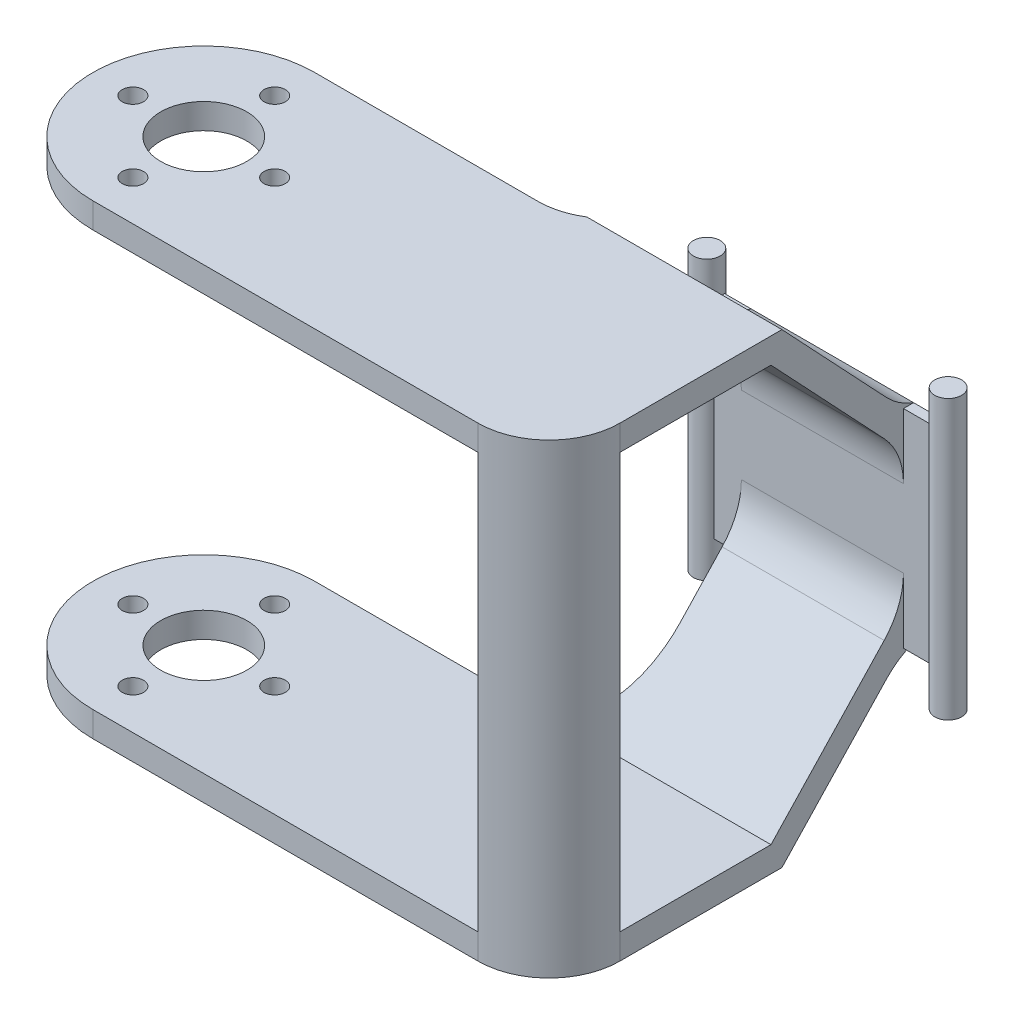
from build123d import *

# Parameters (mm, degrees)
SKETCH1_W           = 23.83
SKETCH1_H           = 1
BOSS_EXTRUDE1_DEPTH = 20.5
SKETCH2_R           = 1.325
BOSS_EXTRUDE2_DEPTH = 13.75
BOSS_EXTRUDE4_DEPTH = 8
SKETCH5_W           = 21.919818374
SKETCH5_H           = 2.5
BOSS_EXTRUDE5_DEPTH = 40
SKETCH6_R           = 4.25
SKETCH6_R_2         = 1.05
CUT_EXTRUDE1_DEPTH  = 76.367433285
FILLET1_R           = 7
FILLET2_R           = 7
FILLET3_R           = 7
BOSS_EXTRUDE6_START = 41
BOSS_EXTRUDE6_DEPTH = 41


with BuildPart() as part:
    # Sketch1 → Boss-Extrude1 (new body)
    with BuildSketch(Plane(origin=(0, 0, 0), x_dir=(1, 0, 0), z_dir=(0, 1, 0))):
        Rectangle(SKETCH1_W, SKETCH1_H)
    extrude(amount=BOSS_EXTRUDE1_DEPTH)

    # Sketch2 → Boss-Extrude2 (add, symmetric)
    with BuildSketch(Plane(origin=(0, 10.25, 0), x_dir=(1, 0, 0), z_dir=(0, 1, 0))):
        with Locations(Location((-11.915, 0, 0), (0, 0, 270))):
            Circle(SKETCH2_R)
        with Locations(Location((11.915, 0, 0), (0, 0, 270))):
            Circle(SKETCH2_R)
    extrude(amount=BOSS_EXTRUDE2_DEPTH, both=True)

    # Sketch4 → Boss-Extrude4 (add, symmetric)
    with BuildSketch(Plane(origin=(0, 0, 0), x_dir=(0, 0, -1), z_dir=(1, 0, 0))):
        Polygon((-0.5, 16.852307022), (-0.5, 20.5), (-12.5, 33.25), (-35.5, 33.25), (-35.5, 30.75), (-13.580181626, 30.75), align=None)
        Polygon((-0.5, 0), (-0.5, 3.647692978), (-13.580181626, -10.25), (-35.5, -10.25), (-35.5, -12.75), (-12.5, -12.75), align=None)
    extrude(amount=BOSS_EXTRUDE4_DEPTH, both=True)

    # Sketch5 → Boss-Extrude5 (add)
    with BuildSketch(Plane.ZY.offset(8)):
        with Locations((24.540090813, 32)):
            Rectangle(SKETCH5_W, SKETCH5_H)
        with Locations((24.540090813, -11.5)):
            Rectangle(SKETCH5_W, SKETCH5_H)
    extrude(amount=BOSS_EXTRUDE5_DEPTH)

    # Sketch6 → Cut-Extrude1 (cut, through all)
    with BuildSketch(Plane(origin=(0, 33.25, 0), x_dir=(1, 0, 0), z_dir=(0, 1, 0))):
        with Locations(Location((-37.040090813, -24.540090813, 0), (0, 0, 270))):
            Circle(SKETCH6_R)
        with Locations(Location((-44.040090813, -24.540090813, 0), (0, 0, 270))):
            Circle(SKETCH6_R_2)
        with Locations(Location((-37.040090813, -17.540090813, 0), (0, 0, 270))):
            Circle(SKETCH6_R_2)
        with Locations(Location((-30.040090813, -24.540090813, 0), (0, 0, 270))):
            Circle(SKETCH6_R_2)
        with Locations(Location((-37.040090813, -31.540090813, 0), (0, 0, 270))):
            Circle(SKETCH6_R_2)
        with BuildLine():
            ThreePointArc((-48, -24.540090813), (-44.78991692, -16.790264706), (-37.040090813, -13.580181626))
            Line((-37.040090813, -13.580181626), (-48, -13.580181626))
            Line((-48, -13.580181626), (-48, -24.540090813))
        make_face()
        with BuildLine():
            ThreePointArc((-37.040090813, -35.5), (-44.78991692, -32.28991692), (-48, -24.540090813))
            Line((-48, -24.540090813), (-48, -35.5))
            Line((-48, -35.5), (-37.040090813, -35.5))
        make_face()
    extrude(amount=-CUT_EXTRUDE1_DEPTH, mode=Mode.SUBTRACT)

    # Fillet1
    # the kernel refuses this fillet: 7 mm, written as the material it adds along each edge
    with BuildSketch(Plane(origin=(-8, -12.75, 13.580181626), x_dir=(-1, 0, 0), z_dir=(0, 1, 0))) as fillet1_piece_1_section:
        with BuildLine():
            CenterArc((FILLET1_R, -FILLET1_R), FILLET1_R, 90, 90)
            Line((0, -FILLET1_R), (0, 0))
            Line((0, 0), (FILLET1_R, 0))
        make_face()
    fillet1_piece_1 = extrude(amount=2.5, mode=Mode.PRIVATE)
    fillet1_piece_1 = split(fillet1_piece_1, bisect_by=Plane(origin=(-10.020174451, -12.153760937, 11.938833823), z_dir=(0, 0.6853646990049913, 0.7281999926928027)), keep=Keep.TOP, mode=Mode.PRIVATE)
    fillet1_piece_1 = split(fillet1_piece_1, bisect_by=Plane(origin=(-10.020174451, -10.440349189, 13.759333804), z_dir=(0, -0.685364699004991, -0.7281999926928029)), keep=Keep.TOP, mode=Mode.PRIVATE)
    add(fillet1_piece_1)
    with BuildSketch(Plane(origin=(-8, -12.75, 13.580181626), x_dir=(-1, 0, 0), z_dir=(0, 1, 0))) as fillet1_piece_2_section:
        with BuildLine():
            CenterArc((FILLET1_R, -FILLET1_R), FILLET1_R, 90, 90)
            Line((0, -FILLET1_R), (0, 0))
            Line((0, 0), (FILLET1_R, 0))
        make_face()
    fillet1_piece_2 = extrude(amount=20, mode=Mode.PRIVATE)
    fillet1_piece_2 = split(fillet1_piece_2, bisect_by=Plane(origin=(-8.816209607, -9.698679662, 9.628169093), z_dir=(0, 0.6853646990049913, 0.7281999926928027)), keep=Keep.TOP, mode=Mode.PRIVATE)
    fillet1_piece_2 = split(fillet1_piece_2, bisect_by=Plane(origin=(-8.816209607, -10.25, 10.809130305), z_dir=(0, 1, 0)), keep=Keep.TOP, mode=Mode.PRIVATE)
    fillet1_piece_2 = split(fillet1_piece_2, bisect_by=Plane(origin=(-8.816209607, -7.985267914, 11.448669075), z_dir=(0, -0.685364699004991, -0.7281999926928029)), keep=Keep.TOP, mode=Mode.PRIVATE)
    add(fillet1_piece_2)
    with BuildSketch(Plane(origin=(-8, 33.25, 13.580181626), x_dir=(0, 0, -1), z_dir=(0, -1, 0))) as fillet1_piece_3_section:
        with BuildLine():
            CenterArc((FILLET1_R, -FILLET1_R), FILLET1_R, 90, 90)
            Line((0, -FILLET1_R), (0, 0))
            Line((0, 0), (FILLET1_R, 0))
        make_face()
    fillet1_piece_3 = extrude(amount=2.5, mode=Mode.PRIVATE)
    fillet1_piece_3 = split(fillet1_piece_3, bisect_by=Plane(origin=(-10.020174451, 32.653760936, 11.938833823), z_dir=(0, -0.6853646990049912, 0.7281999926928028)), keep=Keep.TOP, mode=Mode.PRIVATE)
    fillet1_piece_3 = split(fillet1_piece_3, bisect_by=Plane(origin=(-10.020174451, 30.940349189, 13.759333804), z_dir=(0, 0.6853646990049909, -0.7281999926928031)), keep=Keep.TOP, mode=Mode.PRIVATE)
    add(fillet1_piece_3)
    with BuildSketch(Plane(origin=(-8, 33.25, 13.580181626), x_dir=(0, 0, -1), z_dir=(0, -1, 0))) as fillet1_piece_4_section:
        with BuildLine():
            CenterArc((FILLET1_R, -FILLET1_R), FILLET1_R, 90, 90)
            Line((0, -FILLET1_R), (0, 0))
            Line((0, 0), (FILLET1_R, 0))
        make_face()
    fillet1_piece_4 = extrude(amount=20, mode=Mode.PRIVATE)
    fillet1_piece_4 = split(fillet1_piece_4, bisect_by=Plane(origin=(-8.816209616, 30.198679665, 9.628169097), z_dir=(0, -0.6853646990049912, 0.7281999926928028)), keep=Keep.TOP, mode=Mode.PRIVATE)
    fillet1_piece_4 = split(fillet1_piece_4, bisect_by=Plane(origin=(-8.816209616, 28.485267918, 11.448669078), z_dir=(0, 0.6853646990049909, -0.7281999926928031)), keep=Keep.TOP, mode=Mode.PRIVATE)
    fillet1_piece_4 = split(fillet1_piece_4, bisect_by=Plane(origin=(-8.816209616, 30.75, 10.809130308), z_dir=(0, -1, 0)), keep=Keep.TOP, mode=Mode.PRIVATE)
    add(fillet1_piece_4)
    # the kernel refuses this fillet: 7 mm, written as the material it takes off along each edge
    with BuildSketch(Plane(origin=(8, 7.25, 35.5), x_dir=(0, 0, -1), z_dir=(0, -1, 0))) as fillet1_2_piece_1:
        with BuildLine():
            CenterArc((FILLET1_R, -FILLET1_R), FILLET1_R, 90, 90)
            Line((0, -FILLET1_R), (0, 0))
            Line((0, 0), (FILLET1_R, 0))
        make_face()
    extrude(amount=37.5, mode=Mode.SUBTRACT)
    with BuildSketch(Plane(origin=(8, 50.75, 35.5), x_dir=(-1, 0, 0), z_dir=(0, -1, 0))) as fillet1_2_piece_2:
        with BuildLine():
            CenterArc((FILLET1_R, FILLET1_R), FILLET1_R, 180, 90)
            Line((0, FILLET1_R), (0, 0))
            Line((0, 0), (FILLET1_R, 0))
        make_face()
    extrude(amount=37.5, mode=Mode.SUBTRACT)

    # Fillet2
    fillet2_edges = [part.edges().sort_by_distance(p)[0] for p in [
        (0, 16.852307022, 0.5),
        (0, 3.647692978, 0.5),
    ]]
    fillet(fillet2_edges, radius=FILLET2_R)

    # Fillet3
    # the kernel refuses this fillet: 7 mm, written as the material it adds along each edge
    with BuildSketch(Plane(origin=(-8, 20.5, 0.5), x_dir=(0, 0.7281999926925888, 0.6853646990052185), z_dir=(1, 0, 0))) as fillet3_piece_1:
        with BuildLine():
            CenterArc((2.423417163, -7), FILLET3_R, 90, 26.366519243)
            Line((-0.685364699, -0.728199993), (0, 0))
            Line((0, 0), (2.423417163, 0))
        make_face()
    extrude(amount=16)
    with BuildSketch(Plane(origin=(8, 0, 0.5), x_dir=(0, 0, -1), z_dir=(-1, 0, 0))) as fillet3_piece_2:
        with BuildLine():
            CenterArc((3.436475374, 6.562285254), FILLET3_R, 223.264295411, 26.366519243)
            Line((-1.660924575, 1.764732361), (0, 0))
            Line((0, 0), (1, 0))
        make_face()
    extrude(amount=16)

    # Sketch8 → Boss-Extrude6 (add)
    with BuildSketch(Plane(origin=(0, -10.25, 0), x_dir=(1, 0, 0), z_dir=(0, 1, 0)).offset(BOSS_EXTRUDE6_START)):
        with BuildLine():
            ThreePointArc((1, -35.5), (5.949747468, -33.449747468), (8, -28.5))
            Line((8, -28.5), (5, -28.5))
            ThreePointArc((5, -28.5), (3.422054899, -30.922054899), (1, -32.5))
            Line((1, -32.5), (1, -35.5))
        make_face()
    extrude(amount=-BOSS_EXTRUDE6_DEPTH)


solid = part.part
